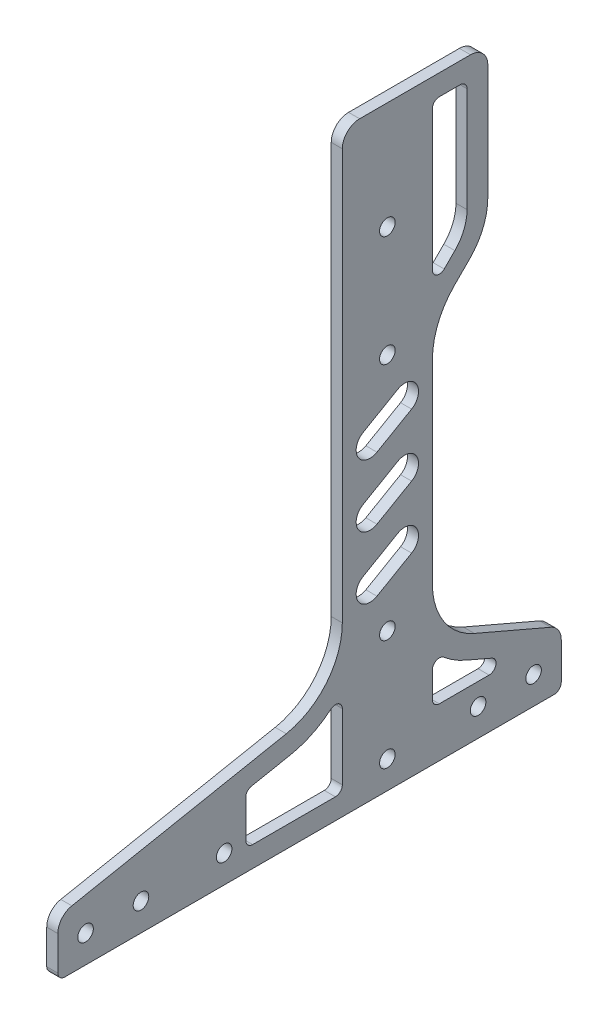
from build123d import *

# Parameters (mm, degrees)
STOCK_SPINE_MASTER_1_START     = 21.5
STOCK_SPINE_MASTER_1_OUTLINE_R = 2.25
STOCK_SPINE_MASTER_1_DEPTH     = 3.2
FILLET1_R                      = 5
FILLET2_R                      = 2
FILLET3_R                      = 20
CUT_EXTRUDE4_DEPTH             = 199.32814828
FILLET4_R                      = 2
CUT_EXTRUDE6_DEPTH             = 199.328148417
LPATTERN2_COUNT                = 2
LPATTERN2_PITCH                = 18
LPATTERN2_COL_COUNT            = 2
LPATTERN2_COL_PITCH            = 18


# Read off the part's stored shape, not the designer's step: Stock-spine_master-1
with BuildPart() as part:
    # Stock-spine_master-1 outline → Stock-spine_master-1 (new body)
    with BuildSketch(Plane.YZ.offset(STOCK_SPINE_MASTER_1_START)):
        with BuildLine():
            Line((-174, -50.2), (-158, -50.2))
            Line((-158, -50.2), (-142, -13))
            Line((-142, -13), (-72.784271247, -13))
            ThreePointArc((-72.784271247, -13), (-64.365235735, -14.674650285), (-57.227922061, -19.443650814))
            Line((-57.227922061, -19.443650814), (-52.943650814, -23.727922061))
            ThreePointArc((-52.943650814, -23.727922061), (-47.104030535, -27.629831585), (-40.215728753, -29))
            Line((-40.215728753, -29), (-2, -29))
            Line((-2, -29), (-2, 13))
            Line((-2, 13), (-142, 13))
            Line((-142, 13), (-158, 95.12))
            Line((-158, 95.12), (-174, 95.12))
            Line((-174, 95.12), (-174, -50.2))
        make_face()
        with Locations((-166, -42.2)):
            Circle(STOCK_SPINE_MASTER_1_OUTLINE_R, mode=Mode.SUBTRACT)
        with Locations((-166, -26.2)):
            Circle(STOCK_SPINE_MASTER_1_OUTLINE_R, mode=Mode.SUBTRACT)
        with Locations((-166, 0)):
            Circle(STOCK_SPINE_MASTER_1_OUTLINE_R, mode=Mode.SUBTRACT)
        with Locations((-134, 0)):
            Circle(STOCK_SPINE_MASTER_1_OUTLINE_R, mode=Mode.SUBTRACT)
        with Locations((-65, 0)):
            Circle(STOCK_SPINE_MASTER_1_OUTLINE_R, mode=Mode.SUBTRACT)
        with Locations((-33, 0)):
            Circle(STOCK_SPINE_MASTER_1_OUTLINE_R, mode=Mode.SUBTRACT)
        with Locations((-166, 47.12)):
            Circle(STOCK_SPINE_MASTER_1_OUTLINE_R, mode=Mode.SUBTRACT)
        with Locations((-166, 71.12)):
            Circle(STOCK_SPINE_MASTER_1_OUTLINE_R, mode=Mode.SUBTRACT)
        with Locations((-166, 87.12)):
            Circle(STOCK_SPINE_MASTER_1_OUTLINE_R, mode=Mode.SUBTRACT)
    extrude(amount=STOCK_SPINE_MASTER_1_DEPTH)

    # Fillet1
    fillet1_edges = [part.edges().sort_by_distance(p)[0] for p in [
        (23.1, -158, 95.12),
        (23.1, -2, 13),
        (23.1, -2, -29),
        (23.1, -158, -50.2),
    ]]
    fillet(fillet1_edges, radius=FILLET1_R)

    # Fillet2
    fillet2_edges = [part.edges().sort_by_distance(p)[0] for p in [
        (23.1, -174, -50.2),
        (23.1, -174, 95.12),
    ]]
    fillet(fillet2_edges, radius=FILLET2_R)

    # Fillet3
    fillet3_edges = [part.edges().sort_by_distance(p)[0] for p in [
        (23.1, -142, 13),
        (23.1, -142, -13),
    ]]
    fillet(fillet3_edges, radius=FILLET3_R)

    # Sketch7 → Cut-Extrude4 (cut, through all)
    with BuildSketch(Plane(origin=(24.7, 0, 0), x_dir=(0, 0, -1), z_dir=(1, 0, 0))):
        with BuildLine():
            Line((-28.027740447, -151.040780627), (-40.87, -153.542925693))
            Line((-40.87, -153.542925693), (-40.87, -168))
            Line((-40.87, -168), (-13, -168))
            Line((-13, -168), (-13, -142.133906195))
            ThreePointArc((-13, -142.133906195), (-19.743434086, -147.887228617), (-28.027740447, -151.040780627))
        make_face()
        with BuildLine():
            Line((23, -8), (13, -8))
            Line((13, -8), (13, -55.463763172))
            ThreePointArc((13, -55.463763172), (14.063796748, -54.191923537), (15.201010127, -52.985281374))
            Line((15.201010127, -52.985281374), (19.485281374, -48.701010127))
            ThreePointArc((19.485281374, -48.701010127), (22.08655439, -44.807929941), (23, -40.215728753))
            Line((23, -40.215728753), (23, -8))
        make_face()
        with BuildLine():
            Line((13, -145.443926245), (13, -159.75))
            Line((13, -159.75), (39.083148267, -159.75))
            Line((39.083148267, -159.75), (22.727111066, -152.71514529))
            ThreePointArc((22.727111066, -152.71514529), (17.433060426, -149.655432834), (13, -145.443926245))
        make_face()
    extrude(amount=-CUT_EXTRUDE4_DEPTH, mode=Mode.SUBTRACT)

    # Fillet4
    fillet4_edges = [part.edges().sort_by_distance(p)[0] for p in [
        (23.1, -168, 13),
        (23.1, -168, 40.87),
        (23.1, -153.542925693, 40.87),
        (23.1, -142.133906195, 13),
        (23.1, -55.463763172, -13),
        (23.1, -145.443926245, -13),
        (23.1, -8, -13),
        (23.1, -159.75, -13),
        (23.1, -159.75, -39.083148267),
        (23.1, -8, -23),
    ]]
    fillet(fillet4_edges, radius=FILLET4_R)

    # Sketch10 → Cut-Extrude6 (cut, through all)
    with BuildSketch(Plane(origin=(24.7, 0, 0), x_dir=(0, 0, -1), z_dir=(1, 0, 0))):
        with BuildLine():
            Line((-7, -98.922649731), (3, -93.149147039))
            ThreePointArc((3, -93.149147039), (8.464101615, -94.613248654), (7, -100.077350269))
            Line((7, -100.077350269), (-3, -105.850852961))
            ThreePointArc((-3, -105.850852961), (-8.464101615, -104.386751346), (-7, -98.922649731))
        make_face()
    cut_extrude6 = extrude(amount=-CUT_EXTRUDE6_DEPTH, mode=Mode.SUBTRACT)

    # LPattern2: Cut-Extrude6 ×2
    with Locations(*[(0, i * LPATTERN2_PITCH, 0) for i in range(1, LPATTERN2_COUNT)]):
        add(cut_extrude6, mode=Mode.SUBTRACT)

    # LPattern2 col: Cut-Extrude6 ×2
    with Locations(*[(0, -i * LPATTERN2_COL_PITCH, 0) for i in range(1, LPATTERN2_COL_COUNT)]):
        add(cut_extrude6, mode=Mode.SUBTRACT)


solid = part.part
